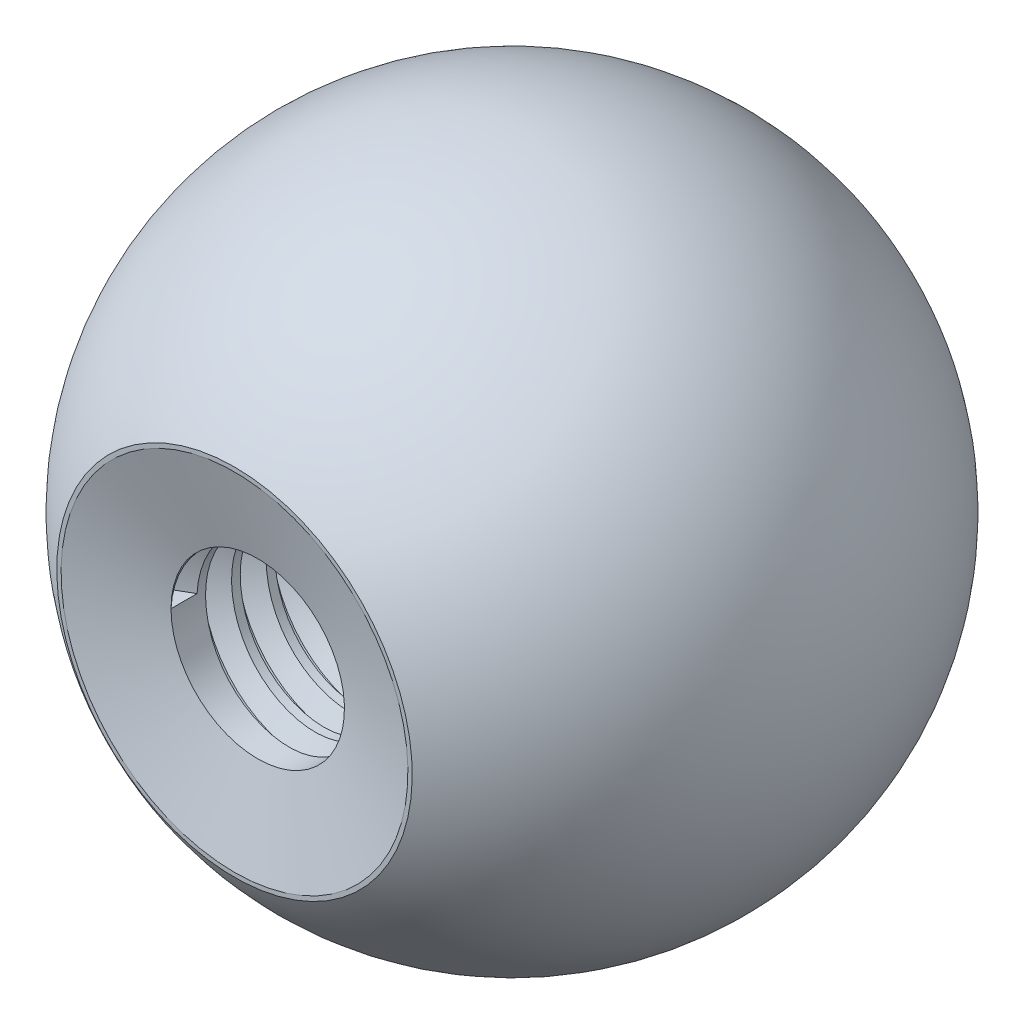
from build123d import *

# Parameters (mm, degrees)
SKETCH34_W                                      = 2.647942017
SKETCH34_H                                      = 8.173696878
CUT_EXTRUDE1_DEPTH                              = 5
CSK_FOR_M3_FLAT_HEAD_MACHINE_SCREW1_D           = 2.5
CSK_FOR_M3_FLAT_HEAD_MACHINE_SCREW1_DEPTH       = 5
CSK_FOR_M3_FLAT_HEAD_MACHINE_SCREW1_CSINK_D     = 5
CSK_FOR_M3_FLAT_HEAD_MACHINE_SCREW1_CSINK_ANGLE = 150
CSK_FOR_M3_FLAT_HEAD_MACHINE_SCREW1_TIP         = 0.751075774
THREAD1_PITCH                                   = 0.5


with BuildPart() as part:
    # Sketch33 → Revolve1 (revolve)
    with BuildSketch(Plane.XY):
        with BuildLine():
            Line((0, 4.75), (0, -4.75))
            ThreePointArc((0, -4.75), (-4.75, 0), (0, 4.75))
        make_face()
    revolve(axis=Axis((0, 4.75, 0), (0, -1, 0)))

    # Sketch34 → Cut-Extrude1 (cut, symmetric)
    with BuildSketch(Plane(origin=(0, 0, 0), x_dir=(0, 0, -1), z_dir=(1, 0, 0))):
        with Locations((-5.323971009, -0.203915987)):
            Rectangle(SKETCH34_W, SKETCH34_H)
    extrude(amount=CUT_EXTRUDE1_DEPTH, both=True, mode=Mode.SUBTRACT)

    # CSK for M3 Flat Head Machine Screw1
    with Locations(Plane(origin=(0, 0, 4), x_dir=(0, 1, 0), z_dir=(0, 0, 1))):
        with Locations((0, 0)):
            CounterSinkHole(CSK_FOR_M3_FLAT_HEAD_MACHINE_SCREW1_D / 2, CSK_FOR_M3_FLAT_HEAD_MACHINE_SCREW1_CSINK_D / 2, depth=CSK_FOR_M3_FLAT_HEAD_MACHINE_SCREW1_DEPTH, counter_sink_angle=CSK_FOR_M3_FLAT_HEAD_MACHINE_SCREW1_CSINK_ANGLE)
            with Locations((0, 0, -(CSK_FOR_M3_FLAT_HEAD_MACHINE_SCREW1_DEPTH + CSK_FOR_M3_FLAT_HEAD_MACHINE_SCREW1_TIP / 2))):  # 118° drill point
                Cone(0, CSK_FOR_M3_FLAT_HEAD_MACHINE_SCREW1_D / 2, CSK_FOR_M3_FLAT_HEAD_MACHINE_SCREW1_TIP, mode=Mode.SUBTRACT)

    # Thread1: the profile of Thread Profile1 profile screwed along a right-hand helix of 10 turns, 6 arcs to a turn; built about Z, then put on its axis
    thread1_z = Axis((0, 0, 0), (0, 0, 1))
    thread1_corners = [(1.2497, 0, -0.000173206), (1.520632937, 0, 0.156249999), (1.520632937, 0, 0.218749999), (1.2497, 0, 0.375173203)]
    with BuildLine(mode=Mode.PRIVATE) as thread1_profile:
        Line(thread1_corners[0], thread1_corners[1])
        Line(thread1_corners[1], thread1_corners[2])
        Line(thread1_corners[2], thread1_corners[3])
        Line(thread1_corners[3], thread1_corners[0])
    thread1_cap = Face(thread1_profile.wire())
    thread1_turn_angles = [0, 30, 60, 90, 120, 150, 180, 210, 240, 270, 300, 330, 360]
    thread1_turn_weights = [1, 0.8660254037844387, 1, 0.8660254037844387, 1, 0.8660254037844387, 1, 0.8660254037844387, 1, 0.8660254037844387, 1, 0.8660254037844387, 1]
    thread1_turn_rails = [Edge.make_bspline([Vector(p[0], p[1], 0).rotate(thread1_z, thread1_turn_angles[k]) / thread1_turn_weights[k] + Vector(0, 0, p[2] + THREAD1_PITCH * thread1_turn_angles[k] / 360) for k in range(13)], [0, 0, 0, 1, 1, 2, 2, 3, 3, 4, 4, 5, 5, 6, 6, 6], 2, thread1_turn_weights) for p in thread1_corners]
    thread1_turn_sides = [Face.make_surface_from_curves(thread1_turn_rails[p[0]], thread1_turn_rails[p[1]]) for p in [(0, 1), (1, 2), (2, 3), (3, 0)]]
    thread1 = Plane(origin=(0, 0, 3.665063509), x_dir=(-1, 0, 0), z_dir=(0, 0, -1)) * Solid(Shell([*[p.moved(Location((0, 0, THREAD1_PITCH * i))) for i in range(10) for p in thread1_turn_sides], thread1_cap, thread1_cap.rotate(thread1_z, 3600).moved(Location((0, 0, THREAD1_PITCH * 3600 / 360)))]))
    add(thread1, mode=Mode.SUBTRACT)


solid = part.part
